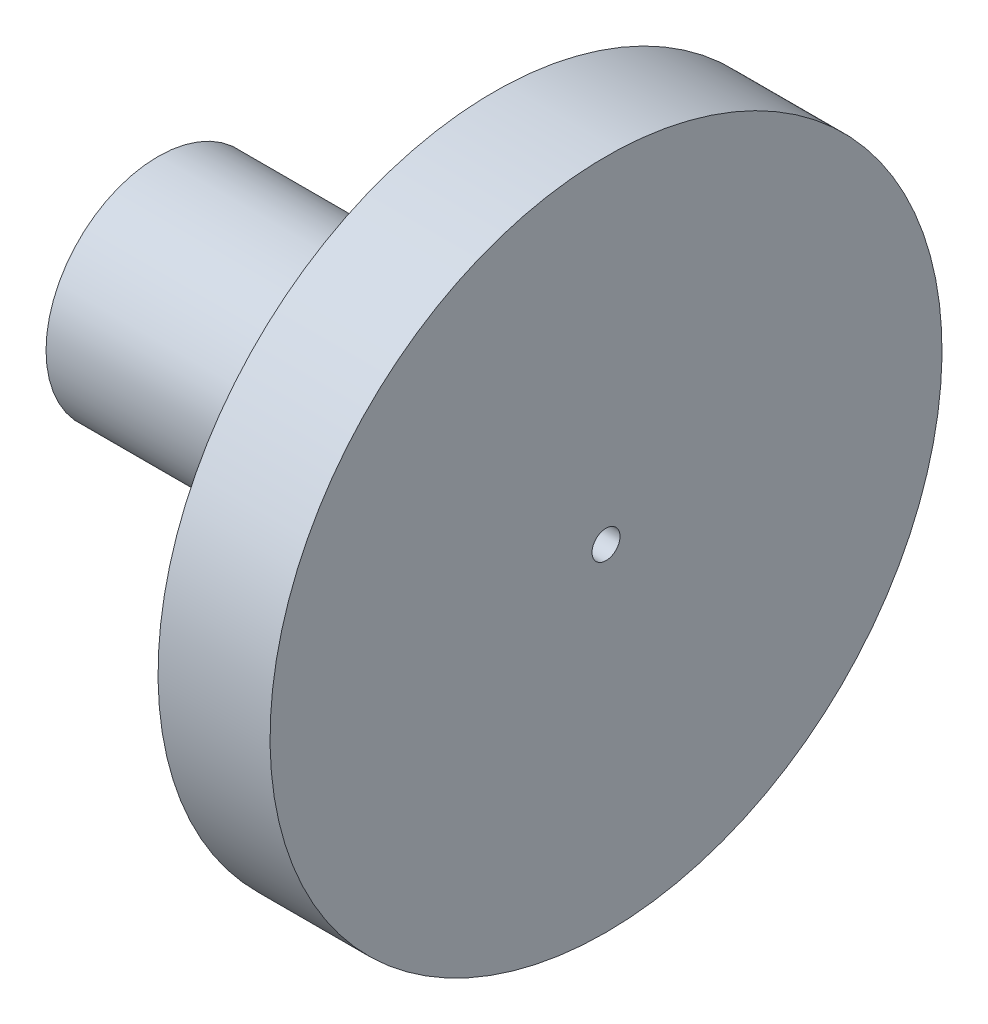
from build123d import *


with BuildPart() as part:
    # Sketch1 → Revolve1 (revolve)
    with BuildSketch(Plane.XY):
        Polygon((5, 10), (5, 4), (36, 4), (36, 1.25), (45, 1.25), (45, 30), (35, 30), (35, 10), align=None)
    revolve(axis=Axis((5, 0, 0), (1, 0, 0)))


solid = part.part
